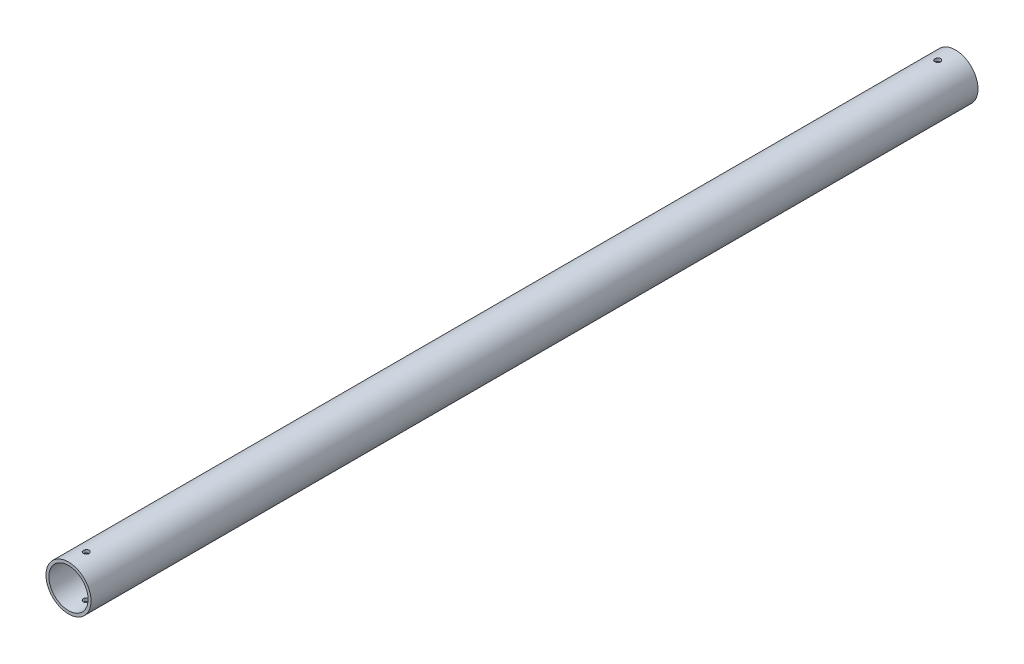
from build123d import *

# Parameters (mm, degrees)
SKETCH1_R           = 12.7
SKETCH1_R_2         = 11.049
BOSS_EXTRUDE1_DEPTH = 250
SKETCH2_R           = 1.6
CUT_EXTRUDE1_DEPTH  = 251.644329679


with BuildPart() as part:
    # Sketch1 → Boss-Extrude1 (new, symmetric)
    with BuildSketch(Plane.XY):
        Circle(SKETCH1_R)
        Circle(SKETCH1_R_2, mode=Mode.SUBTRACT)
    extrude(amount=BOSS_EXTRUDE1_DEPTH, both=True)

    # Sketch2 → Cut-Extrude1 (cut, symmetric)
    with BuildSketch(Plane(origin=(0, 0, 0), x_dir=(1, 0, 0), z_dir=(0, 1, 0))):
        with Locations((0, -240)):
            Circle(SKETCH2_R)
    cut_extrude1 = extrude(amount=CUT_EXTRUDE1_DEPTH, both=True, mode=Mode.SUBTRACT)

    # Mirror1: Cut-Extrude1 across plane
    add(cut_extrude1.mirror(Plane.XY), mode=Mode.SUBTRACT)


solid = part.part
